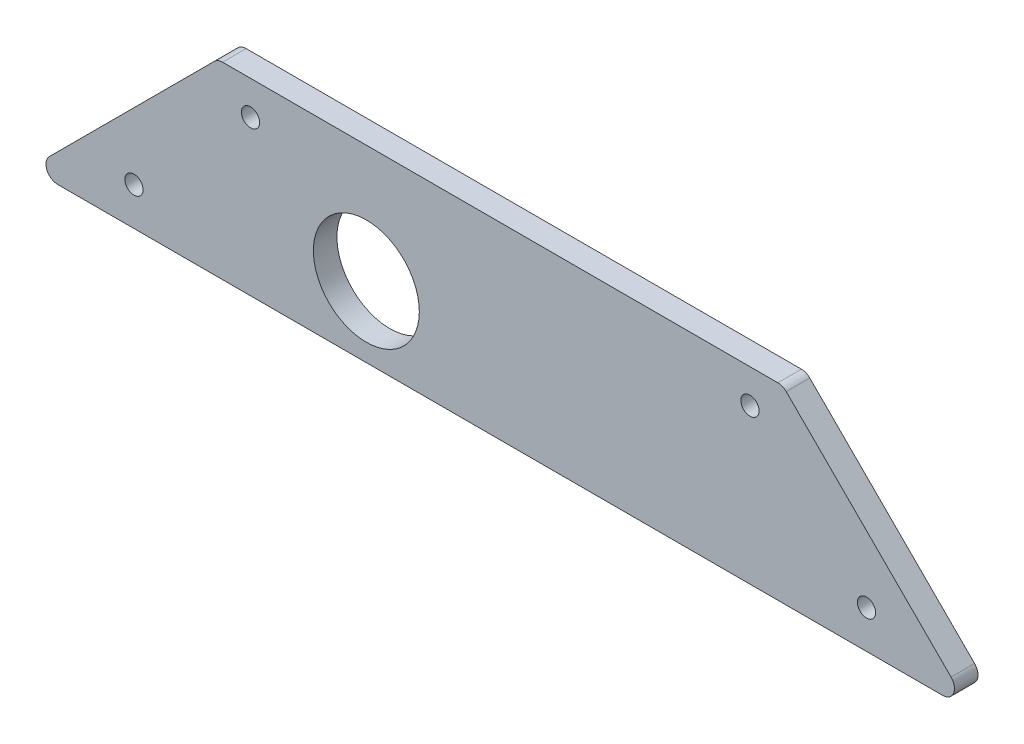
from build123d import *

# Parameters (mm, degrees)
BOSS_EXTRUDE1_DEPTH          = 3.175
SKETCH2_R                    = 14.2875
CUT_EXTRUDE1_DEPTH           = 131.459778054
F_10_0_1935_DIAMETER_HOLE2_D = 4.9149
FILLET1_R                    = 3.175


with BuildPart() as part:
    # Sketch1 → Boss-Extrude1 (new, symmetric)
    with BuildSketch(Plane.XY):
        Polygon((-76.2, 29.162153383), (-127, -21.637846617), (127, -21.637846617), (76.2, 29.162153383), align=None)
    extrude(amount=BOSS_EXTRUDE1_DEPTH, both=True)

    # Sketch2 → Cut-Extrude1 (cut, through all)
    with BuildSketch(Plane.XY.offset(3.175)):
        with Locations((-36.107951031, -2.587846617)):
            Circle(SKETCH2_R)
    extrude(amount=-CUT_EXTRUDE1_DEPTH, mode=Mode.SUBTRACT)

    # #10 (0.1935) Diameter Hole2 (through all)
    with Locations(Plane(origin=(67.351920908, 20.049720233, 3.175), x_dir=(1, 0, 0), z_dir=(0, 0, 1))):
        with Locations((0, 0), (31.430896424, -31.430896424), (-134.703841816, 0), (-166.13473824, -31.430896424)):
            Hole(F_10_0_1935_DIAMETER_HOLE2_D / 2)

    # Fillet1
    fillet1_edges = [part.edges().sort_by_distance(p)[0] for p in [
        (-127, -21.637846617, 0),
        (-76.2, 29.162153383, 0),
        (127, -21.637846617, 0),
        (76.2, 29.162153383, 0),
    ]]
    fillet(fillet1_edges, radius=FILLET1_R)


solid = part.part
